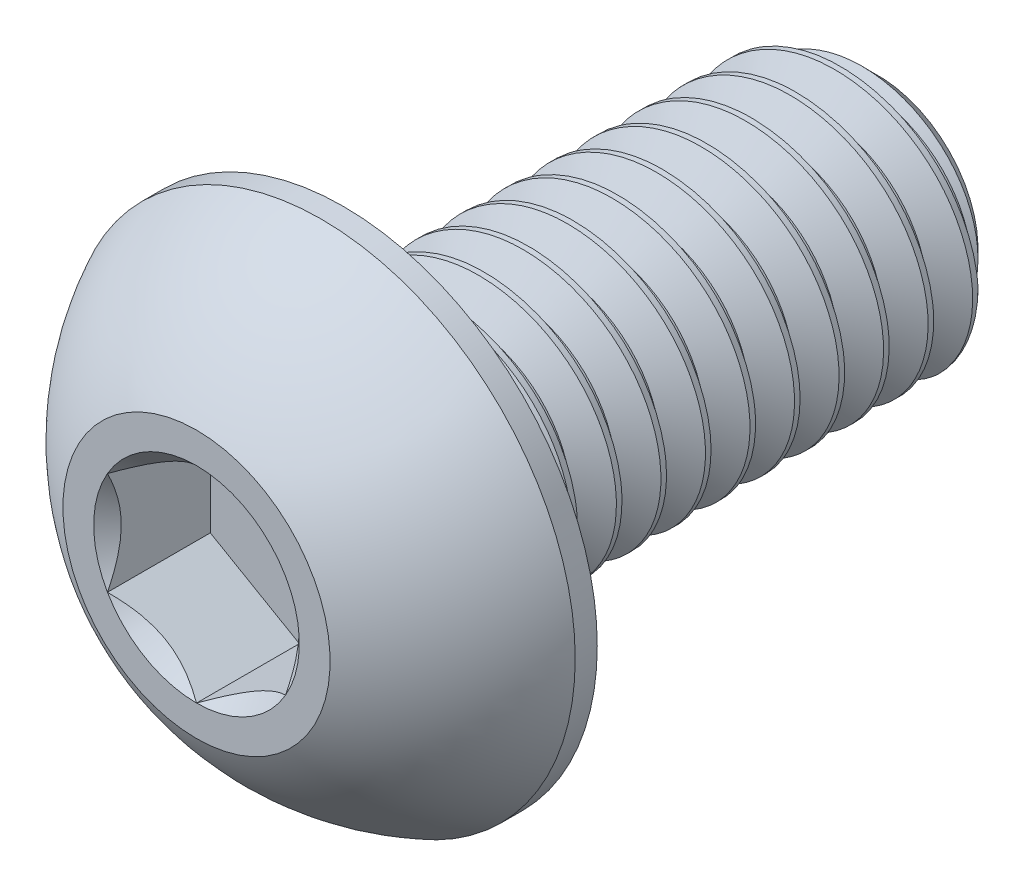
from build123d import *

# Parameters (mm, degrees)
CUT_EXTRUDE2_DEPTH = 1.155
CUT_SWEEP2_PITCH   = 0.5


# Read off the part's stored shape, not the designer's step: Split1, Boss-Extrude1
with BuildPart() as part:
    # Sketch10 → Revolve3 (revolve)
    with BuildSketch(Plane(origin=(0, 0, 0), x_dir=(0, 0, -1), z_dir=(1, 0, 0)), mode=Mode.PRIVATE) as revolve3_sk:
        Polygon((2.625, 1.5), (3, 1.125), (3, 0), (-3, 0), (-3, 1.5), align=None)
    revolve(revolve3_sk.sketch.rotate(Axis((0, 0, 4.65), (0, 0, -1)), 180), axis=Axis((0, 0, 4.65), (0, 0, -1)))

    # Sketch7 → Revolve2 (revolve)
    with BuildSketch(Plane(origin=(0, 0, 0), x_dir=(0, 0, -1), z_dir=(1, 0, 0)), mode=Mode.PRIVATE) as revolve2_sk:
        with BuildLine():
            Line((-3.2475, 2.85), (-3, 2.85))
            Line((-3, 2.85), (-3, 0))
            Line((-3, 0), (-4.65, 0))
            Line((-4.65, 0), (-4.65, 1.5))
            ThreePointArc((-4.65, 1.5), (-4.05487489, 2.285251969), (-3.2475, 2.85))
        make_face()
    revolve(revolve2_sk.sketch.rotate(Axis((0, 0, 4.65), (0, 0, -1)), 180), axis=Axis((0, 0, 4.65), (0, 0, -1)))

    # Sketch5 → Cut-Extrude2 (cut)
    with BuildSketch(Plane.XY.offset(4.65)):
        Polygon((1, -0.577350269), (1, 0.577350269), (0, 1.154700538), (-1, 0.577350269), (-1, -0.577350269), (0, -1.154700538), align=None)
    extrude(amount=-CUT_EXTRUDE2_DEPTH, mode=Mode.SUBTRACT)

    # Cut-Extrude3 cone 1 section (through the dimple's axis) → Cut-Extrude3 (revolve, cut)
    with BuildSketch(Plane(origin=(0, 0, 4.65), x_dir=(0, -1, 0), z_dir=(1, 0, 0))):
        Polygon((0, 0), (1.154700538, 0), (0, 1.154700538), align=None)
    revolve(axis=Axis((0, 0, 4.65), (0, 0, -1)), mode=Mode.SUBTRACT)


with BuildPart() as body_2:
    # Split1: the piece on the far side of the plane
    add(part.part)
    split(bisect_by=Plane.XY.offset(3), keep=Keep.BOTTOM)

    # Cut-Sweep2: the profile of Sketch12 screwed along a right-hand helix of 15.3 turns, 6 arcs to a turn; built about Z, then put on its axis
    cut_sweep2_z = Axis((0, 0, 0), (0, 0, 1))
    cut_sweep2_corners = [(1.175240474, 0, -0.1875), (1.175240474, 0, -0.25), (1.527063294, 0, -0.453125), (1.527063294, 0, 0.015625)]
    with BuildLine(mode=Mode.PRIVATE) as cut_sweep2_profile:
        Line(cut_sweep2_corners[0], cut_sweep2_corners[1])
        Line(cut_sweep2_corners[1], cut_sweep2_corners[2])
        Line(cut_sweep2_corners[2], cut_sweep2_corners[3])
        Line(cut_sweep2_corners[3], cut_sweep2_corners[0])
    cut_sweep2_cap = Face(cut_sweep2_profile.wire())
    cut_sweep2_turn_angles = [0, 30, 60, 90, 120, 150, 180, 210, 240, 270, 300, 330, 360]
    cut_sweep2_turn_weights = [1, 0.8660254037844387, 1, 0.8660254037844387, 1, 0.8660254037844387, 1, 0.8660254037844387, 1, 0.8660254037844387, 1, 0.8660254037844387, 1]
    cut_sweep2_turn_rails = [Edge.make_bspline([Vector(p[0], p[1], 0).rotate(cut_sweep2_z, cut_sweep2_turn_angles[k]) / cut_sweep2_turn_weights[k] + Vector(0, 0, p[2] + CUT_SWEEP2_PITCH * cut_sweep2_turn_angles[k] / 360) for k in range(13)], [0, 0, 0, 1, 1, 2, 2, 3, 3, 4, 4, 5, 5, 6, 6, 6], 2, cut_sweep2_turn_weights) for p in cut_sweep2_corners]
    cut_sweep2_turn_sides = [Face.make_surface_from_curves(cut_sweep2_turn_rails[p[0]], cut_sweep2_turn_rails[p[1]]) for p in [(0, 1), (1, 2), (2, 3), (3, 0)]]
    cut_sweep2_last_angles = [5400, 5430, 5460, 5484, 5508]
    cut_sweep2_last_weights = [1, 0.8660254037844387, 1, 0.9135454576424814, 1]
    cut_sweep2_last_rails = [Edge.make_bspline([Vector(p[0], p[1], 0).rotate(cut_sweep2_z, cut_sweep2_last_angles[k]) / cut_sweep2_last_weights[k] + Vector(0, 0, p[2] + CUT_SWEEP2_PITCH * cut_sweep2_last_angles[k] / 360) for k in range(5)], [0, 0, 0, 1, 1, 2, 2, 2], 2, cut_sweep2_last_weights) for p in cut_sweep2_corners]
    cut_sweep2_last_sides = [Face.make_surface_from_curves(cut_sweep2_last_rails[p[0]], cut_sweep2_last_rails[p[1]]) for p in [(0, 1), (1, 2), (2, 3), (3, 0)]]
    cut_sweep2 = Plane(origin=(0, 0, -3), x_dir=(0, 1, 0), z_dir=(0, 0, 1)) * Solid(Shell([*[p.moved(Location((0, 0, CUT_SWEEP2_PITCH * i))) for i in range(15) for p in cut_sweep2_turn_sides], *cut_sweep2_last_sides, cut_sweep2_cap, cut_sweep2_cap.rotate(cut_sweep2_z, 5508).moved(Location((0, 0, CUT_SWEEP2_PITCH * 5508 / 360)))]))
    add(cut_sweep2, mode=Mode.SUBTRACT)


with BuildPart() as part_1:
    add(part.part)

    # Split1
    split(bisect_by=Plane.XY.offset(3), keep=Keep.TOP)

    add(body_2.part)  # Boss-Extrude1 merges body 2
    # Boss-Extrude1 outline → Boss-Extrude1 (revolve)
    with BuildSketch(Plane.XZ):
        Polygon((1.175240474, 3), (1.175240474, 2.675240474), (1.5, 3), align=None)
    revolve(axis=Axis((0, 0, 0), (0, 0, 1)))


solid = part_1.part
